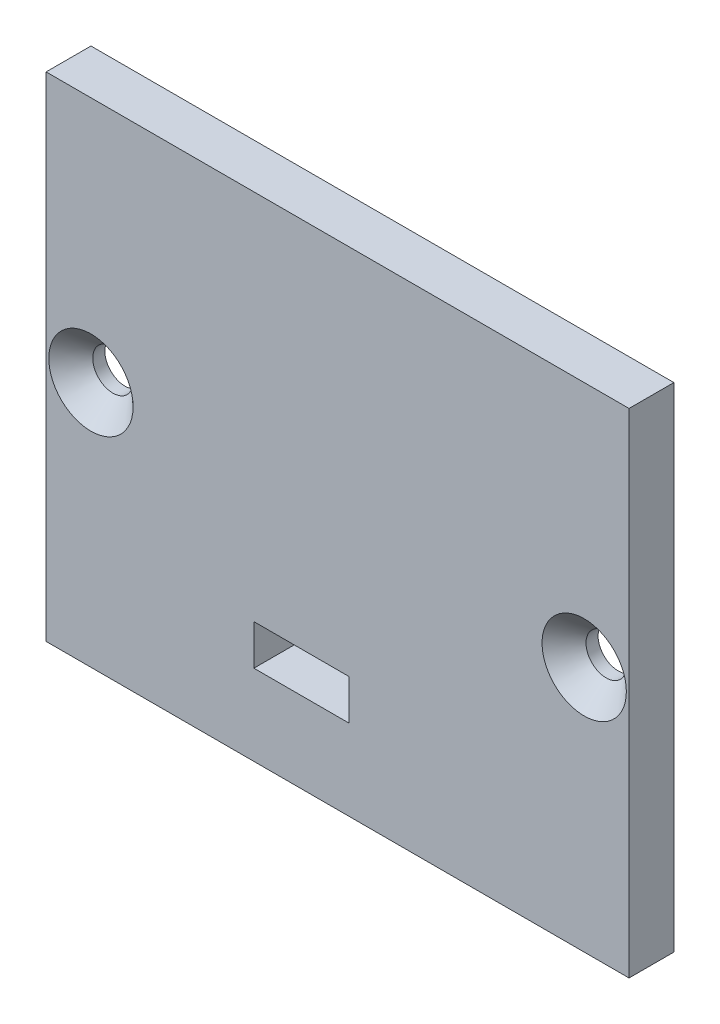
from build123d import *

# Parameters (mm, degrees)
ESQUISSE1_W                                    = 65
ESQUISSE1_H                                    = 55
BOSS_EXTRU_1_DEPTH                             = 5
ESQUISSE2_R                                    = 2
ENL_V_MAT_EXTRU_1_DEPTH                        = 86.293610546
FRAISAGE_POUR_VIS_T_TE_FRAIS_E_M41_D           = 4.5
FRAISAGE_POUR_VIS_T_TE_FRAIS_E_M41_CSINK_D     = 9.4
FRAISAGE_POUR_VIS_T_TE_FRAIS_E_M41_CSINK_ANGLE = 90
ESQUISSE6_W                                    = 10.600064569
ESQUISSE6_H                                    = 4.5
ENL_V_MAT_EXTRU_2_DEPTH                        = 86.293610546
ESQUISSE7_R                                    = 4.6
ENL_V_MAT_EXTRU_3_DEPTH                        = 1.2


with BuildPart() as part:
    # Esquisse1 → Boss.-Extru.1 (new body)
    with BuildSketch(Plane.XY):
        with Locations((32.5, 27.5)):
            Rectangle(ESQUISSE1_W, ESQUISSE1_H)
    extrude(amount=BOSS_EXTRU_1_DEPTH)

    # Esquisse2 → Enlèv. mat.-Extru.1 (cut, through all)
    with BuildSketch(Plane.XY.offset(5)):
        with Locations((5, 27.5)):
            Circle(ESQUISSE2_R)
        with Locations((60, 27.5)):
            Circle(ESQUISSE2_R)
    extrude(amount=-ENL_V_MAT_EXTRU_1_DEPTH, mode=Mode.SUBTRACT)

    # Fraisage pour vis à tête fraisée M41 (through all)
    with Locations(Plane.XY.offset(5)):
        with Locations((5, 27.5), (60, 27.5)):
            CounterSinkHole(FRAISAGE_POUR_VIS_T_TE_FRAIS_E_M41_D / 2, FRAISAGE_POUR_VIS_T_TE_FRAIS_E_M41_CSINK_D / 2, counter_sink_angle=FRAISAGE_POUR_VIS_T_TE_FRAIS_E_M41_CSINK_ANGLE)

    # Esquisse6 → Enlèv. mat.-Extru.2 (cut, through all)
    with BuildSketch(Plane.XY.offset(5)):
        with Locations((28.468386436, 11.25)):
            Rectangle(ESQUISSE6_W, ESQUISSE6_H)
    extrude(amount=-ENL_V_MAT_EXTRU_2_DEPTH, mode=Mode.SUBTRACT)

    # Esquisse7 → Enlèv. mat.-Extru.3 (cut)
    with BuildSketch(Plane(origin=(0, 0, 0), x_dir=(-1, 0, 0), z_dir=(0, 0, -1))):
        with Locations((-60, 27.5)):
            Circle(ESQUISSE7_R)
        with Locations((-5, 27.5)):
            Circle(ESQUISSE7_R)
    extrude(amount=-ENL_V_MAT_EXTRU_3_DEPTH, mode=Mode.SUBTRACT)


solid = part.part
